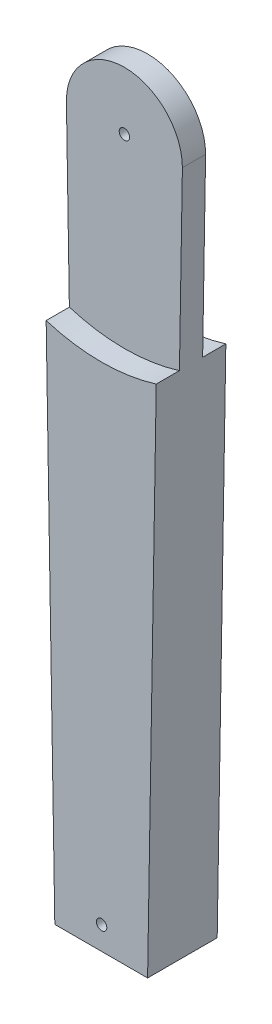
from build123d import *

# Parameters (mm, degrees)
BOSS_EXTRUDE3_DEPTH = 15
CUT_EXTRUDE4_DEPTH  = 10
SKETCH11_R          = 2.25
CUT_EXTRUDE5_DEPTH  = 320
SKETCH14_W          = 20
SKETCH14_H          = 10
CUT_EXTRUDE6_DEPTH  = 20
SKETCH16_R          = 2.25
CUT_EXTRUDE7_DEPTH  = 62.5
SKETCH17_R          = 80
CUT_EXTRUDE9_DEPTH  = 10


with BuildPart() as part:
    # Sketch7 → Boss-Extrude3 (new, symmetric)
    with BuildSketch(Plane.XY):
        with BuildLine():
            ThreePointArc((25, 0), (0, 25), (-25, 0))
            Line((-25, 0), (-20, -300))
            Line((-20, -300), (20, -300))
            Line((20, -300), (25, 0))
        make_face()
    extrude(amount=BOSS_EXTRUDE3_DEPTH, both=True)

    # Sketch10 → Cut-Extrude4 (cut)
    with BuildSketch(Plane.XY.offset(15)):
        with BuildLine():
            Line((-25, 0), (-24.271436464, -43.713812142))
            ThreePointArc((-24.271436464, -43.713812142), (-12.536135627, -48.402947261), (0, -50))
            ThreePointArc((0, -50), (12.536135627, -48.402947261), (24.271436464, -43.713812142))
            Line((24.271436464, -43.713812142), (25, 0))
            ThreePointArc((25, 0), (0, 25), (-25, 0))
        make_face()
    cut_extrude4 = extrude(amount=-CUT_EXTRUDE4_DEPTH, mode=Mode.SUBTRACT)

    # Mirror1: Cut-Extrude4 across plane
    add(cut_extrude4.mirror(Plane.XY), mode=Mode.SUBTRACT)

    # Sketch11 → Cut-Extrude5 (cut)
    with BuildSketch(Plane.XY.offset(5)):
        Circle(SKETCH11_R)
    extrude(amount=-CUT_EXTRUDE5_DEPTH, mode=Mode.SUBTRACT)

    # Sketch14 → Cut-Extrude6 (cut)
    with BuildSketch(Plane.XZ.offset(300)):
        Rectangle(SKETCH14_W, SKETCH14_H)
    extrude(amount=-CUT_EXTRUDE6_DEPTH, mode=Mode.SUBTRACT)

    # Sketch16 → Cut-Extrude7 (cut, symmetric)
    with BuildSketch(Plane.XY.offset(-5)):
        with Locations((0.163889082, -290)):
            Circle(SKETCH16_R)
    extrude(amount=CUT_EXTRUDE7_DEPTH, both=True, mode=Mode.SUBTRACT)

    # Sketch17 → Cut-Extrude9 (cut)
    with BuildSketch(Plane.XY.offset(15)):
        Circle(SKETCH17_R)
    cut_extrude9 = extrude(amount=-CUT_EXTRUDE9_DEPTH, mode=Mode.SUBTRACT)

    # Mirror2: Cut-Extrude9 across plane
    add(cut_extrude9.mirror(Plane(origin=(0, 0, 0), x_dir=(1, 0, 0), z_dir=(0, 0, -1))), mode=Mode.SUBTRACT)


solid = part.part
